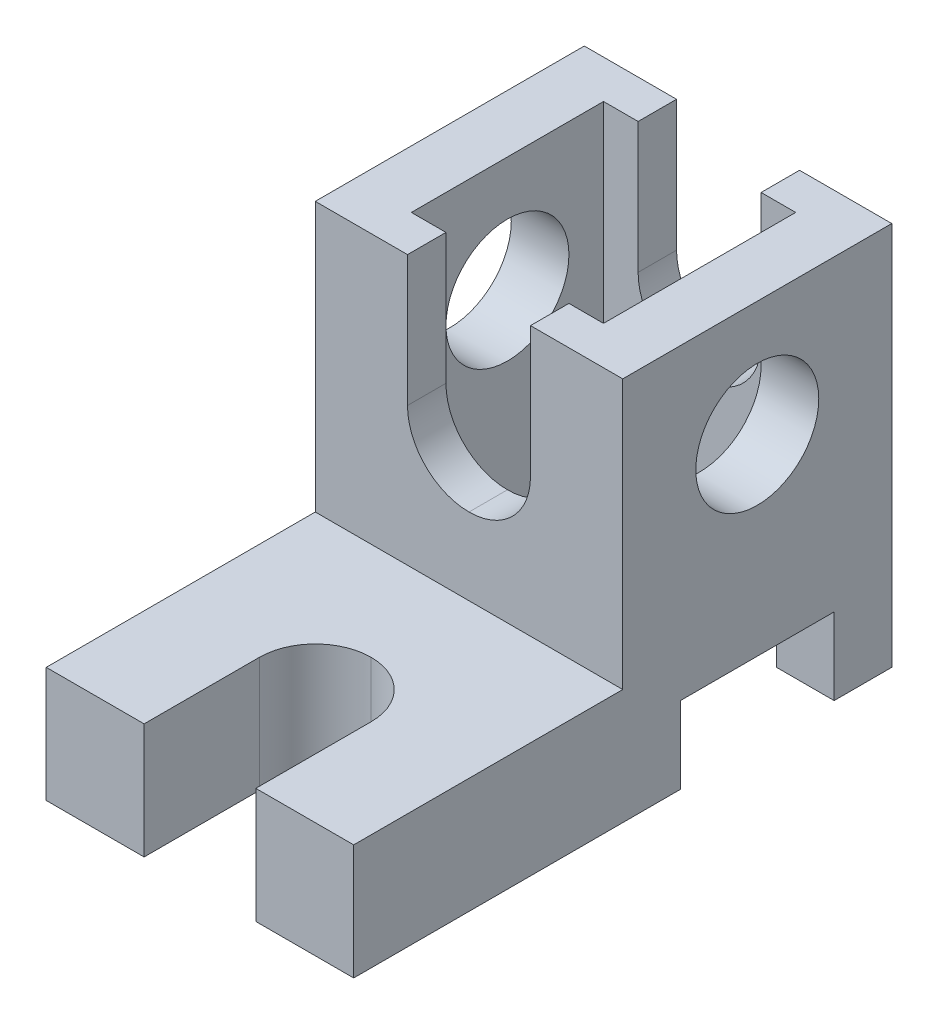
from build123d import *

# Parameters (mm, degrees)
BOSS_EXTRUDE1_DEPTH      = 40
BOSS_EXTRUDE1_DEPTH_BACK = 40
SKETCH1_R                = 16
SKETCH2_W                = 50
SKETCH2_H                = 50
CUT_EXTRUDE1_DEPTH       = 151.416089565
SKETCH3_W                = 32
SKETCH3_H                = 50
CUT_EXTRUDE2_DEPTH       = 129.452325787
FILLET1_R                = 16
SKETCH4_W                = 29.06
SKETCH4_H                = 44.53
CUT_EXTRUDE3_DEPTH       = 133.382022949
FILLET2_R                = 14.53


with BuildPart() as part:
    # Sketch1 → Boss-Extrude1 (new, two sides: drawn at the far end of the back side and taken through both)
    with BuildSketch(Plane(origin=(0, 0, 0), x_dir=(0, 0, -1), z_dir=(1, 0, 0)).offset(-BOSS_EXTRUDE1_DEPTH_BACK)):
        Polygon((-105, 0), (-20, 0), (-20, 20), (20, 20), (20, 0), (35, 0), (35, 100), (-35, 100), (-35, 30), (-105, 30), align=None)
        with Locations((0, 70)):
            Circle(SKETCH1_R, mode=Mode.SUBTRACT)
    extrude(amount=BOSS_EXTRUDE1_DEPTH + BOSS_EXTRUDE1_DEPTH_BACK)

    # Sketch2 → Cut-Extrude1 (cut, through all)
    with BuildSketch(Plane(origin=(0, 100, 0), x_dir=(1, 0, 0), z_dir=(0, 1, 0))):
        Rectangle(SKETCH2_W, SKETCH2_H)
    extrude(amount=-CUT_EXTRUDE1_DEPTH, mode=Mode.SUBTRACT)

    # Sketch3 → Cut-Extrude2 (cut, through all)
    with BuildSketch(Plane.XY.offset(35)):
        with Locations((0, 75)):
            Rectangle(SKETCH3_W, SKETCH3_H)
    extrude(amount=-CUT_EXTRUDE2_DEPTH, mode=Mode.SUBTRACT)

    # Fillet1
    fillet1_edges = [part.edges().sort_by_distance(p)[0] for p in [
        (-16, 50, -30),
        (16, 50, -30),
        (16, 50, 30),
        (-16, 50, 30),
    ]]
    fillet(fillet1_edges, radius=FILLET1_R - 0.0001)  # a hair under: the kernel refuses the full size

    # Sketch4 → Cut-Extrude3 (cut, through all)
    with BuildSketch(Plane(origin=(0, 30, 0), x_dir=(1, 0, 0), z_dir=(0, 1, 0))):
        with Locations((0, -82.735)):
            Rectangle(SKETCH4_W, SKETCH4_H)
    extrude(amount=-CUT_EXTRUDE3_DEPTH, mode=Mode.SUBTRACT)

    # Fillet2
    fillet2_edges = [part.edges().sort_by_distance(p)[0] for p in [
        (14.53, 15, 60.47),
        (-14.53, 15, 60.47),
    ]]
    fillet(fillet2_edges, radius=FILLET2_R - 0.0001)  # a hair under: the kernel refuses the full size


solid = part.part
